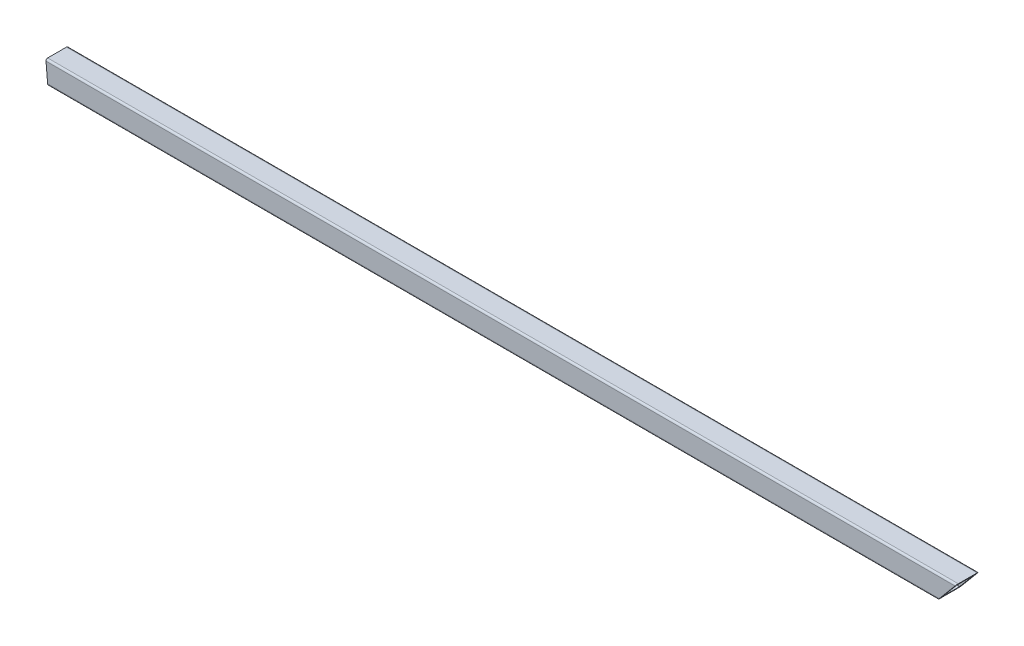
from build123d import *

# Parameters (mm, degrees)
SKETCH1_W           = 23.495
SKETCH1_H           = 23.495
BOSS_EXTRUDE1_DEPTH = 1320.8
SCALE4_SCALE_X      = 1
SCALE4_SCALE_Y      = 0.4
SCALE4_SCALE_Z      = 0.4
CUT_EXTRUDE2_DEPTH  = 1322.04802369


with BuildPart() as part:
    # Sketch1 → Boss-Extrude1 (new body)
    with BuildSketch(Plane(origin=(0, 0, 0), x_dir=(0, 0, -1), z_dir=(1, 0, 0))):
        with BuildLine():
            Line((0, 2.54), (0, 29.21))
            ThreePointArc((0, 29.21), (-0.743948776, 31.006051224), (-2.54, 31.75))
            Line((-2.54, 31.75), (-29.21, 31.75))
            ThreePointArc((-29.21, 31.75), (-31.006051224, 31.006051224), (-31.75, 29.21))
            Line((-31.75, 29.21), (-31.75, 2.54))
            ThreePointArc((-31.75, 2.54), (-31.006051224, 0.743948776), (-29.21, 0))
            Line((-29.21, 0), (-2.54, 0))
            ThreePointArc((-2.54, 0), (-0.743948776, 0.743948776), (0, 2.54))
        make_face()
        with Locations((-15.875, 15.875)):
            Rectangle(SKETCH1_W, SKETCH1_H, mode=Mode.SUBTRACT)
    extrude(amount=BOSS_EXTRUDE1_DEPTH)


with BuildPart() as part_1:
    # Scale4: scaled about (660.4, 15.875, 15.875)
    add(part.part.scale((SCALE4_SCALE_X, SCALE4_SCALE_Y, SCALE4_SCALE_Z), about=(660.4, 15.875, 15.875)))

    # Sketch8 → Cut-Extrude2 (cut, through all)
    with BuildSketch(Plane.XY.offset(22.225)):
        Polygon((515.705060634, 22.225), (505.048495318, 9.525), (644.192147645, 9.525), (654.848712961, 22.225), align=None)
        Polygon((0, 22.225), (1.111106027, 9.525), (0, 9.525), align=None)
    extrude(amount=-CUT_EXTRUDE2_DEPTH, mode=Mode.SUBTRACT)


with BuildPart() as body_2:
    # of the pieces the cut leaves, the one that is kept (cut_extrude2_keep)
    add(part_1.part.solids().sort_by_distance((0.088888482, 21.209, 9.525))[0])


solid = body_2.part
